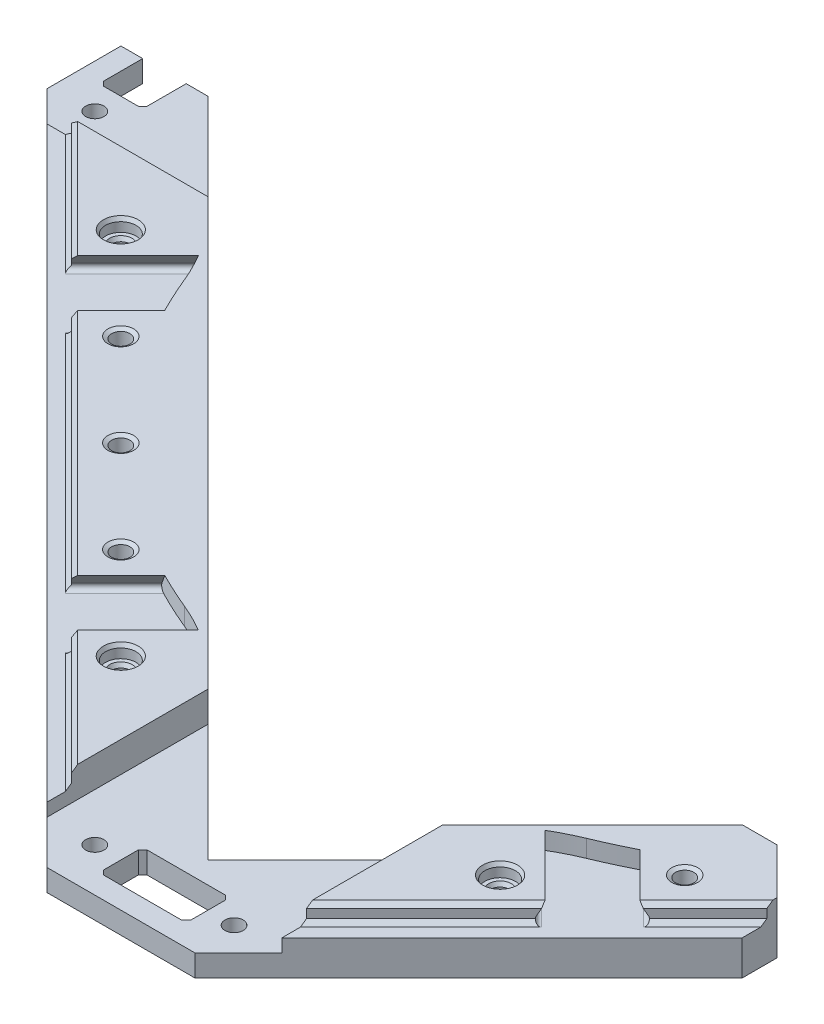
from build123d import *
from OCP.BRepFilletAPI import BRepFilletAPI_MakeChamfer

# Parameters (mm, degrees)
MAIN_BASE_EXTRUDE_DEPTH             = 12
SKETCH3_W                           = 47
SKETCH3_H                           = 27
SKETCH3_W_2                         = 27
SKETCH3_H_2                         = 47
TRACK_SEAT_CUT_DEPTH                = 7
DOVETAIL_CUT_DEPTH                  = 244.837035743
DOVETAIL_CORNER_FILLET_R            = 1
DOVETAIL_CIRCLE_FILL_REACH          = 245.541
DOVETAIL_COVER_CUT_REACH            = 245.541
DOVETAIL_COVER_CUT_CHAMFERS_SIZE    = 1
SKETCH2_R                           = 2.1
TRACK_CONNECT_HOLES_DEPTH           = 244.540551038
WALL_SPACED_HOLES_DEPTH             = 244.540551043
WALL_SPACED_HOLES_DEPTH_BACK        = 244.540551043
SKETCH5_R                           = 2.1
SKETCH18_R                          = 3.5
WALL_SPACED_HOLES_COUNTERSINK_DEPTH = 3
WALL_SPACED_HOLES_CHAMFER_SIZE      = 0.5
WALL_SPACED_HOLES_CHAMFER_SIZE2     = 0.866025404
SKETCH9_W                           = 10
SKETCH9_H                           = 10
WIRE_PASSTHROUGH_CUT_DEPTH          = 244.345433492
WIRE_PASSTHROUGH_CHAMFER_SIZE       = 1
SKETCH13_R                          = 3.075
MAGNET_SEAT_CUT_DEPTH               = 3
MAGNET_SEAT_ENTRY_CHAMFER_SIZE      = 0.5
MAGNET_SEAT_PRINT_CHAMFER_SIZE      = 1
BODY_CIRCULAR_PATTERN_COUNT         = 2
BODY_CIRCULAR_PATTERN_ANGLE         = 90
RIGHT_ARM_CUT_DEPTH                 = 385.790852282
RIGHT_ARM_CUT_DEPTH_BACK            = 385.790852282


with BuildPart() as part:
    # Sketch1 → Main Base Extrude (new body)
    with BuildSketch(Plane(origin=(0, 0, 0), x_dir=(1, 0, 0), z_dir=(0, 1, 0))):
        Polygon((0, 0), (20, 0), (172, -152), (172, -172), (155, -172), (0, -17), align=None)
    extrude(amount=MAIN_BASE_EXTRUDE_DEPTH)

    # Sketch3 → Track Seat Cut (cut)
    with BuildSketch(Plane(origin=(0, 12, 0), x_dir=(1, 0, 0), z_dir=(0, 1, 0))):
        with Locations((23.5, -13.5)):
            Rectangle(SKETCH3_W, SKETCH3_H)
        with Locations((158.5, -148.5)):
            Rectangle(SKETCH3_W_2, SKETCH3_H_2)
    extrude(amount=-TRACK_SEAT_CUT_DEPTH, mode=Mode.SUBTRACT)

    # Sketch14 → Dovetail Cut (cut, through all)
    with BuildSketch(Plane(origin=(-8.5, 0, 8.5), x_dir=(0.707106781186549, 0, 0.7071067811865461), z_dir=(-0.7071067811865461, 0, 0.707106781186549))):
        Polygon((84.312965287, 12), (86.622366364, 8), (66.622366364, 8), (68.931767441, 12), align=None)
        Polygon((176.622366364, 8), (174.312965287, 12), (158.931767441, 12), (156.622366364, 8), align=None)
    extrude(amount=-DOVETAIL_CUT_DEPTH, mode=Mode.SUBTRACT)

    # Dovetail Corner Fillet
    dovetail_corner_fillet_edges = [part.edges().sort_by_distance(p)[0] for p in [
        (125.640872965, 8, 124.140872965),
        (111.498737342, 8, 109.998737342),
        (62.001262658, 8, 60.501262658),
        (47.859127035, 8, 46.359127035),
    ]]
    fillet(dovetail_corner_fillet_edges, radius=DOVETAIL_CORNER_FILLET_R)

    # Dovetail Circle Fill: up to this face of the body (flat: up to its plane)
    dovetail_circle_fill_end = Plane(part.part.faces().sort_by_distance((54.930194847, 8, 53.430194847))[0])
    # Sketch15 → Dovetail Circle Fill (add, up to the picked face)
    with BuildSketch(Plane(origin=(0, 12, 0), x_dir=(1, 0, 0), z_dir=(0, 1, 0)), mode=Mode.PRIVATE) as dovetail_circle_fill_sk1:
        with BuildLine():
            Line((142.040010921, -122.040010921), (49.959989079, -29.959989079))
            ThreePointArc((49.959989079, -29.959989079), (56.182925585, -37.543993978), (60.805230383, -46.197107141))
            ThreePointArc((60.805230383, -46.197107141), (86.833809512, -85.166190488), (125.802892859, -111.194769617))
            ThreePointArc((125.802892859, -111.194769617), (134.456006022, -115.817074415), (142.040010921, -122.040010921))
        make_face()
    dovetail_circle_fill_tool1 = split(extrude(dovetail_circle_fill_sk1.sketch, amount=-DOVETAIL_CIRCLE_FILL_REACH, mode=Mode.PRIVATE), bisect_by=dovetail_circle_fill_end, keep=Keep.BOTH, mode=Mode.PRIVATE)
    add(dovetail_circle_fill_tool1.solids().sort_by(Axis((92.365337, 12, 79.634663), (0, -1, 0)))[0])

    # Dovetail Cover Cut: up to this face of the body (flat: up to its plane)
    dovetail_cover_cut_end = Plane(part.part.faces().sort_by_distance((53.216890879, 8, 54.605388107))[0])
    # Sketch19 → Dovetail Cover Cut (cut, up to the picked face)
    with BuildSketch(Plane(origin=(0, 12, 0), x_dir=(1, 0, 0), z_dir=(0, 1, 0)), mode=Mode.PRIVATE) as dovetail_cover_cut_sk1:
        Polygon((10, -27), (145, -162), (145, -156.343145751), (15.656854249, -27), align=None)
    dovetail_cover_cut_tool1 = split(extrude(dovetail_cover_cut_sk1.sketch, amount=-DOVETAIL_COVER_CUT_REACH, mode=Mode.PRIVATE), bisect_by=dovetail_cover_cut_end, keep=Keep.BOTH, mode=Mode.PRIVATE)
    add(dovetail_cover_cut_tool1.solids().sort_by(Axis((78.904126, 12, 93.095874), (0, -1, 0)))[0], mode=Mode.SUBTRACT)

    # Dovetail Cover Cut Chamfers
    dovetail_cover_cut_chamfers_edges = [part.edges().sort_by_distance(p)[0] for p in [
        (29.363700785, 12, 40.706846536),
        (80.328427125, 12, 91.671572875),
        (131.293153464, 12, 142.636299215),
        (131.497277609, 8, 142.84042336),
        (80.328427125, 8, 91.671572875),
        (29.15957664, 8, 40.502722391),
    ]]
    chamfer(dovetail_cover_cut_chamfers_edges, length=DOVETAIL_COVER_CUT_CHAMFERS_SIZE)

    # Sketch2 → Track Connect Holes (cut, through all)
    with BuildSketch(Plane(origin=(0, 12, 0), x_dir=(1, 0, 0), z_dir=(0, 1, 0))):
        with Locations(Location((10, -16, 0), (0, 0, 270))):
            Circle(SKETCH2_R)
        with Locations(Location((156, -162, 0), (0, 0, 270))):
            Circle(SKETCH2_R)
    extrude(amount=-TRACK_CONNECT_HOLES_DEPTH, mode=Mode.SUBTRACT)

    # Sketch5 → Wall Spaced Holes (cut, two sides: drawn at the far end of the back side and taken through both)
    with BuildSketch(Plane(origin=(0, 0, 0), x_dir=(1, 0, 0), z_dir=(0, 1, 0)).offset(-WALL_SPACED_HOLES_DEPTH_BACK)):
        with Locations(Location((128.411688245, -128.441125497, 0), (0, 0, 270))):
            Circle(SKETCH5_R)
        with Locations(Location((107.19848481, -107.227922061, 0), (0, 0, 270))):
            Circle(SKETCH5_R)
        with Locations(Location((43.558874503, -43.588311755, 0), (0, 0, 90))):
            Circle(SKETCH5_R)
        with Locations(Location((64.772077939, -64.80151519, 0), (0, 0, 90))):
            Circle(SKETCH5_R)
        with Locations(Location((85.985281374, -86.014718626, 0), (0, 0, 270))):
            Circle(SKETCH5_R)
    extrude(amount=WALL_SPACED_HOLES_DEPTH + WALL_SPACED_HOLES_DEPTH_BACK, mode=Mode.SUBTRACT)

    # Sketch18 → Wall Spaced Holes Countersink (cut)
    with BuildSketch(Plane(origin=(0, 12, 0), x_dir=(1, 0, 0), z_dir=(0, 1, 0))):
        with Locations(Location((43.558874503, -43.588311755, 0), (0, 0, 270))):
            Circle(SKETCH18_R)
        with Locations(Location((128.411688245, -128.441125497, 0), (0, 0, 270))):
            Circle(SKETCH18_R)
    extrude(amount=-WALL_SPACED_HOLES_COUNTERSINK_DEPTH, mode=Mode.SUBTRACT)

    # Wall Spaced Holes Chamfer: one chamfer whose edges measure the first distance from different faces: ONE call of the kernel's chamfer builder (chamfer() names one face for all edges)
    wall_spaced_holes_chamfer_edges_1 = [part.edges().sort_by_distance(p)[0] for p in [
        (64.772077939, 12, 66.90151519),
    ]]
    wall_spaced_holes_chamfer_side_1 = [part.faces().sort_by_distance(p)[0] for p in [
        (64.772077939, 6, 66.90151519),
    ]]
    wall_spaced_holes_chamfer_edges_2 = [part.edges().sort_by_distance(p)[0] for p in [
        (107.19848481, 12, 105.127922061),
    ]]
    wall_spaced_holes_chamfer_side_2 = [part.faces().sort_by_distance(p)[0] for p in [
        (107.19848481, 6, 105.127922061),
    ]]
    wall_spaced_holes_chamfer_edges_3 = [part.edges().sort_by_distance(p)[0] for p in [
        (85.985281374, 12, 83.914718626),
    ]]
    wall_spaced_holes_chamfer_side_3 = [part.faces().sort_by_distance(p)[0] for p in [
        (85.985281374, 6, 83.914718626),
    ]]
    wall_spaced_holes_chamfer_edges_4 = [part.edges().sort_by_distance(p)[0] for p in [
        (43.558874503, 9, 45.688311755),
    ]]
    wall_spaced_holes_chamfer_side_4 = [part.faces().sort_by_distance(p)[0] for p in [
        (43.558874503, 9, 40.187306704),
    ]]
    wall_spaced_holes_chamfer_edges_5 = [part.edges().sort_by_distance(p)[0] for p in [
        (43.558874503, 12, 40.088311755),
        (128.411688245, 12, 124.941125497),
    ]]
    wall_spaced_holes_chamfer_side_5 = [part.faces().sort_by_distance(p)[0] for p in [
        (88.49268676, 12, 83.50731324),
    ]]
    wall_spaced_holes_chamfer_edges_6 = [part.edges().sort_by_distance(p)[0] for p in [
        (128.411688245, 9, 126.341125497),
    ]]
    wall_spaced_holes_chamfer_side_6 = [part.faces().sort_by_distance(p)[0] for p in [
        (128.411688245, 9, 125.040120446),
    ]]
    wall_spaced_holes_chamfer = BRepFilletAPI_MakeChamfer(part.part.solid().wrapped)
    for e in wall_spaced_holes_chamfer_edges_1:
        wall_spaced_holes_chamfer.Add(WALL_SPACED_HOLES_CHAMFER_SIZE, WALL_SPACED_HOLES_CHAMFER_SIZE2, e.wrapped, wall_spaced_holes_chamfer_side_1[0].wrapped)  # the first distance lies on this face
    for e in wall_spaced_holes_chamfer_edges_2:
        wall_spaced_holes_chamfer.Add(WALL_SPACED_HOLES_CHAMFER_SIZE, WALL_SPACED_HOLES_CHAMFER_SIZE2, e.wrapped, wall_spaced_holes_chamfer_side_2[0].wrapped)  # the first distance lies on this face
    for e in wall_spaced_holes_chamfer_edges_3:
        wall_spaced_holes_chamfer.Add(WALL_SPACED_HOLES_CHAMFER_SIZE, WALL_SPACED_HOLES_CHAMFER_SIZE2, e.wrapped, wall_spaced_holes_chamfer_side_3[0].wrapped)  # the first distance lies on this face
    for e in wall_spaced_holes_chamfer_edges_4:
        wall_spaced_holes_chamfer.Add(WALL_SPACED_HOLES_CHAMFER_SIZE, WALL_SPACED_HOLES_CHAMFER_SIZE2, e.wrapped, wall_spaced_holes_chamfer_side_4[0].wrapped)  # the first distance lies on this face
    for e in wall_spaced_holes_chamfer_edges_5:
        wall_spaced_holes_chamfer.Add(WALL_SPACED_HOLES_CHAMFER_SIZE, WALL_SPACED_HOLES_CHAMFER_SIZE2, e.wrapped, wall_spaced_holes_chamfer_side_5[0].wrapped)  # the first distance lies on this face
    for e in wall_spaced_holes_chamfer_edges_6:
        wall_spaced_holes_chamfer.Add(WALL_SPACED_HOLES_CHAMFER_SIZE, WALL_SPACED_HOLES_CHAMFER_SIZE2, e.wrapped, wall_spaced_holes_chamfer_side_6[0].wrapped)  # the first distance lies on this face
    add(Compound.cast(wall_spaced_holes_chamfer.Shape()), mode=Mode.REPLACE)

    # Sketch9 → Wire Passthrough Cut (cut, through all)
    with BuildSketch(Plane(origin=(0, 5, 0), x_dir=(1, 0, 0), z_dir=(0, 1, 0))):
        with Locations((10, -5)):
            Rectangle(SKETCH9_W, SKETCH9_H)
        with Locations((167, -162)):
            Rectangle(SKETCH9_W, SKETCH9_H)
    extrude(amount=-WIRE_PASSTHROUGH_CUT_DEPTH, mode=Mode.SUBTRACT)

    # Wire Passthrough Chamfer
    wire_passthrough_chamfer_edges = [part.edges().sort_by_distance(p)[0] for p in [
        (5, 2.5, 10),
        (15, 2.5, 10),
        (162, 2.5, 167),
        (162, 2.5, 157),
    ]]
    chamfer(wire_passthrough_chamfer_edges, length=WIRE_PASSTHROUGH_CHAMFER_SIZE)

    # Sketch13 → Magnet Seat Cut (cut)
    with BuildSketch(Plane.XZ):
        with Locations(Location((64.772077939, 64.80151519, 0), (0, 0, 270))):
            Circle(SKETCH13_R)
        with Locations(Location((107.19848481, 107.227922061, 0), (0, 0, 270))):
            Circle(SKETCH13_R)
        with Locations(Location((85.985281374, 86.014718626, 0), (0, 0, 270))):
            Circle(SKETCH13_R)
    extrude(amount=-MAGNET_SEAT_CUT_DEPTH, mode=Mode.SUBTRACT)

    # Magnet Seat Entry Chamfer
    magnet_seat_entry_chamfer_edges = [part.edges().sort_by_distance(p)[0] for p in [
        (64.772077939, 0, 67.87651519),
        (107.19848481, 0, 110.302922061),
        (85.985281374, 0, 89.089718626),
    ]]
    chamfer(magnet_seat_entry_chamfer_edges, length=MAGNET_SEAT_ENTRY_CHAMFER_SIZE)

    # Magnet Seat Print Chamfer
    # the kernel refuses this chamfer: 1 mm, written as the material it takes off along each edge
    with BuildSketch(Plane(origin=(64.772077939, 3, 64.80151519), x_dir=(0, 0, -1), z_dir=(-1, 0, 0))) as magnet_seat_print_chamfer_piece_1_section:
        Polygon((2.1 + MAGNET_SEAT_PRINT_CHAMFER_SIZE, 0), (2.1, -MAGNET_SEAT_PRINT_CHAMFER_SIZE), (2.1, 0), align=None)
    magnet_seat_print_chamfer_piece_1 = revolve(axis=Axis((64.772077939, 3, 64.80151519), (0, -1, 0)), mode=Mode.PRIVATE)
    magnet_seat_print_chamfer_piece_1 = magnet_seat_print_chamfer_piece_1 & Plane(origin=(64.772077939, 3.512294382, 64.80151519), x_dir=(0, 0, -1), z_dir=(0, -1, 0)) * Cylinder(3.075, 13, mode=Mode.PRIVATE)
    add(magnet_seat_print_chamfer_piece_1, mode=Mode.SUBTRACT)
    with BuildSketch(Plane(origin=(107.19848481, 3, 107.227922061), x_dir=(0, 0, 1), z_dir=(1, 0, 0))) as magnet_seat_print_chamfer_piece_2_section:
        Polygon((2.1 + MAGNET_SEAT_PRINT_CHAMFER_SIZE, 0), (2.1, -MAGNET_SEAT_PRINT_CHAMFER_SIZE), (2.1, 0), align=None)
    magnet_seat_print_chamfer_piece_2 = revolve(axis=Axis((107.19848481, 3, 107.227922061), (0, -1, 0)), mode=Mode.PRIVATE)
    magnet_seat_print_chamfer_piece_2 = magnet_seat_print_chamfer_piece_2 & Plane(origin=(107.19848481, 3.512294382, 107.227922061), x_dir=(0, 0, -1), z_dir=(0, -1, 0)) * Cylinder(3.075, 13, mode=Mode.PRIVATE)
    add(magnet_seat_print_chamfer_piece_2, mode=Mode.SUBTRACT)
    with BuildSketch(Plane(origin=(85.985281374, 3, 86.014718626), x_dir=(0, 0, 1), z_dir=(1, 0, 0))) as magnet_seat_print_chamfer_piece_3_section:
        Polygon((2.1 + MAGNET_SEAT_PRINT_CHAMFER_SIZE, 0), (2.1, -MAGNET_SEAT_PRINT_CHAMFER_SIZE), (2.1, 0), align=None)
    magnet_seat_print_chamfer_piece_3 = revolve(axis=Axis((85.985281374, 3, 86.014718626), (0, -1, 0)), mode=Mode.PRIVATE)
    magnet_seat_print_chamfer_piece_3 = magnet_seat_print_chamfer_piece_3 & Plane(origin=(85.985281374, 3.512294382, 86.014718626), x_dir=(0, 0, -1), z_dir=(0, -1, 0)) * Cylinder(3.075, 13, mode=Mode.PRIVATE)
    add(magnet_seat_print_chamfer_piece_3, mode=Mode.SUBTRACT)


with BuildPart() as body_circular_pattern_1:
    # Body Circular Pattern: pattern copy
    add(part.part.rotate(Axis((172, 0, 0), (0, 1, 0)), 1 * BODY_CIRCULAR_PATTERN_ANGLE / (BODY_CIRCULAR_PATTERN_COUNT - 1)))

    # Body Pattern Combine: union part
    add(part.part)

    # Sketch11 → Right Arm Cut (cut, two sides: drawn at the far end of the back side and taken through both)
    with BuildSketch(Plane(origin=(0, 12, 0), x_dir=(1, 0, 0), z_dir=(0, 1, 0)).offset(-RIGHT_ARM_CUT_DEPTH_BACK)):
        Polygon((241.393398282, -90.606601718), (251.893398282, -101.106601718), (251.893398282, -109.106601718), (255.893398282, -105.106601718), (344, -17), (344, 20), (233.393398282, -90.606601718), align=None)
    extrude(amount=RIGHT_ARM_CUT_DEPTH + RIGHT_ARM_CUT_DEPTH_BACK, mode=Mode.SUBTRACT)


solid = body_circular_pattern_1.part
